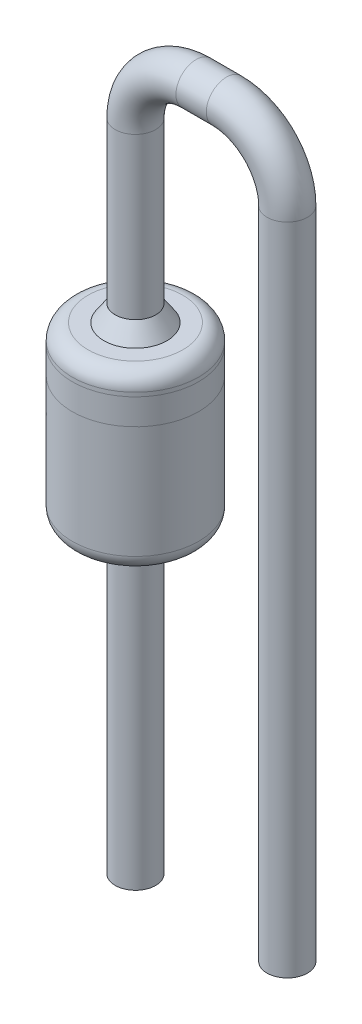
from build123d import *

# Parameters (mm, degrees)
SKETCH6_R = 0.254


with BuildPart() as part:
    # Sketch10 → BODY_main (revolve)
    with BuildSketch(Plane.XY):
        with BuildLine():
            Line((-0.594375, 3.39), (-0.39625, 3.39))
            Line((-0.39625, 3.39), (-0.39625, 1.21))
            Line((-0.39625, 1.21), (-0.594375, 1.21))
            ThreePointArc((-0.594375, 1.21), (-0.734470531, 1.268029469), (-0.7925, 1.408125))
            Line((-0.7925, 1.408125), (-0.7925, 3.191875))
            ThreePointArc((-0.7925, 3.191875), (-0.734470531, 3.331970531), (-0.594375, 3.39))
        make_face()
    revolve(axis=Axis((0, 1, 0), (0, 1, 0)))


with BuildPart() as body_2:
    # Sketch11 → BODY_to_PIN (revolve)
    with BuildSketch(Plane.XY):
        Polygon((0, 1.21), (0, 1), (-0.254, 1), (-0.39625, 1.21), align=None)
        Polygon((-0.39625, 3.39), (0, 3.39), (0, 3.6), (-0.254, 3.6), align=None)
    revolve(axis=Axis((0, 1, 0), (0, 1, 0)))


with BuildPart() as body_3:
    # PINS: sweep along a path in Sketch7
    with BuildLine(Plane.XY) as pins_path:
        Line((0, -2.6), (0, 5.612553199))
        ThreePointArc((0, 5.612553199), (0.223184633, 6.151368566), (0.762, 6.374553199))
        Line((0.762, 6.374553199), (1.143, 6.374553199))
        ThreePointArc((1.143, 6.374553199), (1.681815367, 6.151368566), (1.905, 5.612553199))
        Line((1.905, 5.612553199), (1.905, -2.6))
    # Sketch6 → PINS (sweep)
    with BuildSketch(Plane(origin=(1, 1, 0), x_dir=(0, 0, -1), z_dir=(0, 1, 0))):
        with Locations((0, 1)):
            Circle(SKETCH6_R)
    sweep(path=pins_path.line)


solid = Compound([part.part, body_2.part, body_3.part])
